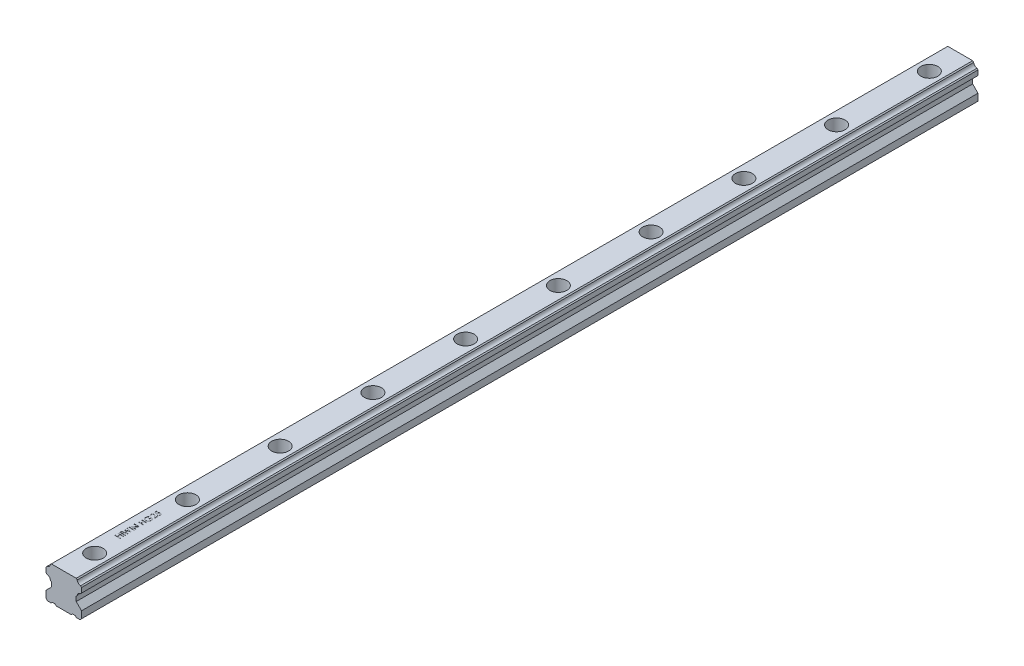
from build123d import *

# Parameters (mm, degrees)
EXTRUDE_1_DEPTH              = 580
HOLE_WIZARD_M6_1_D           = 7
HOLE_WIZARD_M6_1_CBORE_D     = 11
HOLE_WIZARD_M6_1_CBORE_DEPTH = 9
PATTERN_LINEAR_1_COUNT       = 10
PATTERN_LINEAR_1_PITCH       = 60
SKETCH_6_W                   = 3.5
SKETCH_6_H                   = 0.314102564
CUT_EXTRUDE_1_DEPTH          = 0.1


with BuildPart() as part:
    # 草图1 → 凸台-拉伸1 (new body)
    with BuildSketch(Plane.XY):
        with BuildLine():
            Line((8.05, 8.95), (8.05, 11.95))
            Line((8.05, 11.95), (8.699273501, 12.599273501))
            ThreePointArc((8.699273501, 12.599273501), (9.368413601, 14.081586399), (10.850726499, 14.750726499))
            Line((10.850726499, 14.750726499), (11.5, 15.4))
            Line((11.5, 15.4), (11.5, 18.55))
            Line((11.5, 18.55), (10.850726499, 19.199273501))
            ThreePointArc((10.850726499, 19.199273501), (9.368413601, 19.868413601), (8.699273501, 21.350726499))
            Line((8.699273501, 21.350726499), (8.05, 22))
            Line((8.05, 22), (-8.05, 22))
            Line((-8.05, 22), (-8.699273501, 21.350726499))
            ThreePointArc((-8.699273501, 21.350726499), (-9.368413601, 19.868413601), (-10.850726499, 19.199273501))
            Line((-10.850726499, 19.199273501), (-11.5, 18.55))
            Line((-11.5, 18.55), (-11.5, 15.4))
            Line((-11.5, 15.4), (-10.850726499, 14.750726499))
            ThreePointArc((-10.850726499, 14.750726499), (-9.368413601, 14.081586399), (-8.699273501, 12.599273501))
            Line((-8.699273501, 12.599273501), (-8.05, 11.95))
            Line((-8.05, 11.95), (-8.05, 8.95))
            Line((-8.05, 8.95), (-11.5, 5.5))
            Line((-11.5, 5.5), (-11.5, 1))
            Line((-11.5, 1), (-10.5, 0))
            Line((-10.5, 0), (-8.214285714, 0))
            Line((-8.214285714, 0), (-7.447619048, 0.766666667))
            Line((-7.447619048, 0.766666667), (-5.695238095, 0.766666667))
            Line((-5.695238095, 0.766666667), (-4.928571429, 0))
            Line((-4.928571429, 0), (4.928571429, 0))
            Line((4.928571429, 0), (5.695238095, 0.766666667))
            Line((5.695238095, 0.766666667), (7.447619048, 0.766666667))
            Line((7.447619048, 0.766666667), (8.214285714, 0))
            Line((8.214285714, 0), (10.5, 0))
            Line((10.5, 0), (11.5, 1))
            Line((11.5, 1), (11.5, 5.5))
            Line((11.5, 5.5), (8.05, 8.95))
        make_face()
    extrude(amount=-EXTRUDE_1_DEPTH)

    # M6 六角凹头螺钉的柱形沉头孔1 (through all)
    with Locations(Plane(origin=(-2.772540883, 22, -12.140035403), x_dir=(-1, 0, 0), z_dir=(0, 1, 0))):
        with Locations((-2.772540883, -7.859964597)):
            hole_wizard_m6_1 = CounterBoreHole(HOLE_WIZARD_M6_1_D / 2, HOLE_WIZARD_M6_1_CBORE_D / 2, HOLE_WIZARD_M6_1_CBORE_DEPTH)

    # 阵列(线性)1: M6 六角凹头螺钉的柱形沉头孔1 ×10
    with Locations(*[(0, 0, -i * PATTERN_LINEAR_1_PITCH) for i in range(1, PATTERN_LINEAR_1_COUNT)]):
        add(hole_wizard_m6_1, mode=Mode.SUBTRACT)

    # 草图6 → 切除-拉伸1 (cut)
    with BuildSketch(Plane(origin=(0, 22, 0), x_dir=(1, 0, 0), z_dir=(0, 1, 0))):
        Polygon((-3.5, 36.403846154), (-3.5, 36.717948718), (-2.064102564, 36.717948718), (-2.064102564, 38.512820513), (-3.5, 38.512820513), (-3.5, 38.826923077), (0, 38.826923077), (0, 38.512820513), (-1.705128205, 38.512820513), (-1.705128205, 36.717948718), (0, 36.717948718), (0, 36.403846154), align=None)
        with Locations((-1.75, 39.881410256)):
            Rectangle(SKETCH_6_W, SKETCH_6_H)
        Polygon((-3.5, 40.576923077), (-3.5, 40.901542468), (-0.933193109, 41.586538462), (-3.5, 42.605268429), (-3.5, 42.650841346), (-0.950721154, 43.650641026), (-3.5, 44.339142628), (-3.5, 44.66025641), (0, 43.716546474), (0, 43.671674679), (-2.676883013, 42.618589744), (0, 41.552884615), (0, 41.508012821), align=None)
        with Locations((-1.75, 45.625)):
            Rectangle(SKETCH_6_W, SKETCH_6_H)
        Polygon((0, 46.544871795), (-3.5, 46.544871795), (-3.5, 46.610777244), (-0.745292468, 48.923076923), (-3.5, 48.923076923), (-3.5, 49.237179487), (0, 49.237179487), (0, 49.165665064), (-2.748397436, 46.858974359), (0, 46.858974359), align=None)
        Polygon((-3.5, 51.480769231), (-3.5, 51.794871795), (-2.064102564, 51.794871795), (-2.064102564, 53.58974359), (-3.5, 53.58974359), (-3.5, 53.903846154), (0, 53.903846154), (0, 53.58974359), (-1.705128205, 53.58974359), (-1.705128205, 51.794871795), (0, 51.794871795), (0, 51.480769231), align=None)
        with BuildLine():
            Line((-2.902644231, 58.076923077), (-2.647435897, 57.807692308))
            add(Edge.make_bspline(
                [(-2.647435897, 57.807692308), (-2.69328212, 57.758983227), (-2.783881335, 57.662726562), (-2.901244074, 57.50552662), (-3.002777003, 57.342170767), (-3.084772592, 57.172394867), (-3.149094254, 57.000650867), (-3.195850217, 56.829891913), (-3.225460377, 56.661223615), (-3.229016796, 56.549059313), (-3.230769231, 56.493790064)],
                knots=[0, 0, 0, 0, 1.089067066, 2.152164705, 3.18986567, 4.218445106, 5.218487318, 6.173592265, 7.100032889, 8, 8, 8, 8], degree=3))
            add(Edge.make_bspline(
                [(-3.230769231, 56.493790064), (-3.230355625, 56.459875364), (-3.229529486, 56.392133924), (-3.218985271, 56.29151198), (-3.203820407, 56.191945342), (-3.181878529, 56.093621968), (-3.15406947, 55.99635068), (-3.119284004, 55.900469793), (-3.078728771, 55.805800421), (-3.031866252, 55.713234402), (-2.980386575, 55.623493669), (-2.923337414, 55.538737672), (-2.862550889, 55.458421211), (-2.796491613, 55.384072004), (-2.725807311, 55.31519549), (-2.651770944, 55.250524789), (-2.572926872, 55.191265211), (-2.489599321, 55.138479571), (-2.403726867, 55.090811977), (-2.316037795, 55.049619777), (-2.227346143, 55.013809823), (-2.136984078, 54.986535862), (-2.045883197, 54.963434988), (-1.953566086, 54.947353752), (-1.859791669, 54.938257435), (-1.796993971, 54.936686944), (-1.765424679, 54.935897436)],
                knots=[0, 0, 0, 0, 1.028150113, 2.053633673, 3.06513288, 4.081487945, 5.106702018, 6.131327874, 7.172780699, 8.228344599, 9.276313556, 10.308389736, 11.324843658, 12.329040066, 13.321460474, 14.316307835, 15.308626991, 16.309440696, 17.305625405, 18.28535951, 19.246194545, 20.203493668, 21.145557131, 22.095268976, 23.042464743, 24, 24, 24, 24], degree=3))
            add(Edge.make_bspline(
                [(-1.765424679, 54.935897436), (-1.733154018, 54.936653631), (-1.668700816, 54.938163957), (-1.572504414, 54.947817154), (-1.477747832, 54.965772364), (-1.384282029, 54.989584114), (-1.291920993, 55.019856789), (-1.20076111, 55.057049303), (-1.110811241, 55.101355435), (-1.022964324, 55.152526704), (-0.937464192, 55.209036172), (-0.856251713, 55.271187356), (-0.780271995, 55.339084893), (-0.708415252, 55.411483836), (-0.641134974, 55.489043832), (-0.579242122, 55.572517364), (-0.521779643, 55.660735956), (-0.469378807, 55.753738745), (-0.42257144, 55.850542725), (-0.38094723, 55.949799156), (-0.346667976, 56.051827058), (-0.31872985, 56.156089724), (-0.295829559, 56.262463002), (-0.281097077, 56.371486803), (-0.270406246, 56.482359512), (-0.269624576, 56.557098144), (-0.269230769, 56.594751603)],
                knots=[0, 0, 0, 0, 0.935915162, 1.869274651, 2.799799983, 3.730201895, 4.664668062, 5.616159355, 6.583070886, 7.570012957, 8.562524459, 9.553461134, 10.53281078, 11.515274572, 12.509912756, 13.507571325, 14.526460018, 15.561318395, 16.601025881, 17.643204557, 18.680545676, 19.719612342, 20.772381578, 21.833430283, 22.908478249, 24, 24, 24, 24], degree=3))
            add(Edge.make_bspline(
                [(-0.269230769, 56.594751603), (-0.270178952, 56.640130135), (-0.272040863, 56.729238255), (-0.286546735, 56.860222075), (-0.309173205, 56.986034693), (-0.342412256, 57.106266531), (-0.384484705, 57.221353926), (-0.436513285, 57.330872414), (-0.497950569, 57.435124408), (-0.567552463, 57.533658668), (-0.645100929, 57.624132689), (-0.728035637, 57.706474768), (-0.817431068, 57.77785339), (-0.911954918, 57.840400707), (-1.012511326, 57.892097951), (-1.118540888, 57.934543829), (-1.230109213, 57.967076285), (-1.307200733, 57.980431374), (-1.346153846, 57.987179487)],
                knots=[0, 0, 0, 0, 1.130199668, 2.219330667, 3.279027493, 4.311506524, 5.322739849, 6.327972234, 7.327472899, 8.33386792, 9.329086447, 10.29244429, 11.240784345, 12.174119183, 13.111530729, 14.052100829, 15.015757696, 16, 16, 16, 16], degree=3))
            Line((-1.346153846, 57.987179487), (-1.346153846, 56.820512821))
            Line((-1.346153846, 56.820512821), (-1.705128205, 56.820512821))
            Line((-1.705128205, 56.820512821), (-1.705128205, 58.301282051))
            add(Edge.make_bspline(
                [(-1.705128205, 58.301282051), (-1.638220716, 58.299576203), (-1.507270675, 58.296237549), (-1.316300404, 58.272818634), (-1.13592871, 58.235002122), (-0.965965639, 58.18334181), (-0.806652046, 58.116466529), (-0.65782618, 58.035094001), (-0.520449499, 57.93792188), (-0.393400495, 57.828411438), (-0.280071283, 57.705511481), (-0.180465345, 57.572542861), (-0.09656273, 57.429285892), (-0.028302067, 57.275876085), (0.024971927, 57.112815651), (0.062743504, 56.939727272), (0.085373467, 56.756845671), (0.088264847, 56.631508994), (0.08974359, 56.567407853)],
                knots=[0, 0, 0, 0, 1.140356446, 2.231883559, 3.274166699, 4.278491846, 5.25512956, 6.21435461, 7.1637429, 8.11826594, 9.068280886, 10.0076534, 10.945064095, 11.891975133, 12.864533718, 13.863980011, 14.907571808, 16, 16, 16, 16], degree=3))
            add(Edge.make_bspline(
                [(0.08974359, 56.567407853), (0.089174469, 56.527897717), (0.088051978, 56.449970996), (0.080074631, 56.334880068), (0.067794054, 56.222962448), (0.049248931, 56.114234439), (0.026534277, 56.008296097), (-0.002552442, 55.905676512), (-0.036221141, 55.80598477), (-0.074516815, 55.709066784), (-0.118888472, 55.615802237), (-0.168198111, 55.52577572), (-0.222191472, 55.438489595), (-0.281802318, 55.35453843), (-0.346584778, 55.273484808), (-0.416668697, 55.195851364), (-0.491839816, 55.121203486), (-0.545218826, 55.074443023), (-0.572115385, 55.05088141)],
                knots=[0, 0, 0, 0, 1.107784379, 2.184907829, 3.233506516, 4.263428166, 5.276301166, 6.270063455, 7.25232949, 8.225834625, 9.190232166, 10.146266622, 11.1027726, 12.066435141, 13.031522626, 14.010570082, 14.99756817, 16, 16, 16, 16], degree=3))
            add(Edge.make_bspline(
                [(-0.572115385, 55.05088141), (-0.614786038, 55.016695478), (-0.699419055, 54.948891066), (-0.835018999, 54.861612909), (-0.975420859, 54.787211506), (-1.121015488, 54.726843684), (-1.271666701, 54.679705598), (-1.427181992, 54.645899345), (-1.587761622, 54.626092056), (-1.696426887, 54.623238518), (-1.751402244, 54.621794872)],
                knots=[0, 0, 0, 0, 1.023165419, 2.029347347, 3.013907458, 3.994755782, 4.975994455, 5.96558838, 6.970761222, 8, 8, 8, 8], degree=3))
            add(Edge.make_bspline(
                [(-1.751402244, 54.621794872), (-1.792568496, 54.62232711), (-1.874377804, 54.623384821), (-1.99583511, 54.636210339), (-2.115135808, 54.654611751), (-2.232182344, 54.681658827), (-2.347053012, 54.715755013), (-2.45980069, 54.758308794), (-2.570493643, 54.807852572), (-2.67836343, 54.865442289), (-2.782003044, 54.929511026), (-2.880905313, 54.999118682), (-2.973467332, 55.074802367), (-3.059903521, 55.156782462), (-3.141494975, 55.243406392), (-3.216537375, 55.336492693), (-3.286205011, 55.434631029), (-3.349159221, 55.538582169), (-3.405727075, 55.6467058), (-3.455315154, 55.758766886), (-3.496298775, 55.874724704), (-3.531072472, 55.993712261), (-3.556787635, 56.11662974), (-3.575436374, 56.242585283), (-3.588196976, 56.372235393), (-3.589223231, 56.459871423), (-3.58974359, 56.504306891)],
                knots=[0, 0, 0, 0, 1.00895651, 2.005089799, 2.991467152, 3.967318338, 4.948153826, 5.927364234, 6.919980553, 7.91976625, 8.923240147, 9.905815003, 10.88314567, 11.851989312, 12.825009789, 13.798721852, 14.781296708, 15.773896486, 16.776076962, 17.771600213, 18.775744723, 19.78957137, 20.808953803, 21.851964491, 22.910847925, 24, 24, 24, 24], degree=3))
            add(Edge.make_bspline(
                [(-3.58974359, 56.504306891), (-3.589164098, 56.540545135), (-3.588015034, 56.612401313), (-3.580050386, 56.719327046), (-3.567426505, 56.82460006), (-3.550199718, 56.92837645), (-3.526736028, 57.030302816), (-3.498657743, 57.130669522), (-3.46596592, 57.229622058), (-3.426977074, 57.326850307), (-3.382723449, 57.423008023), (-3.332910027, 57.518629864), (-3.276685022, 57.61338911), (-3.213881487, 57.707450091), (-3.145578069, 57.801405949), (-3.069821245, 57.893770591), (-2.989598489, 57.986773536), (-2.931916305, 58.04657535), (-2.902644231, 58.076923077)],
                knots=[0, 0, 0, 0, 0.985871117, 1.954866573, 2.915460327, 3.869826059, 4.81536089, 5.759505086, 6.70452669, 7.649098992, 8.607881297, 9.583363685, 10.581137262, 11.603961102, 12.659522466, 13.73993555, 14.853081303, 16, 16, 16, 16], degree=3))
        make_face()
        with BuildLine():
            Line((-2.423076923, 59.153846154), (-2.423076923, 58.83974359))
            add(Edge.make_bspline(
                [(-2.423076923, 58.83974359), (-2.464747811, 58.841790743), (-2.546588325, 58.845811297), (-2.665912232, 58.864639586), (-2.779967031, 58.891580463), (-2.887836945, 58.929671917), (-2.990475752, 58.976978195), (-3.087475767, 59.033708222), (-3.178466956, 59.100902073), (-3.262605799, 59.177108807), (-3.33979337, 59.259877446), (-3.406448613, 59.349183385), (-3.462766284, 59.443028413), (-3.509847526, 59.541127812), (-3.545187372, 59.644588375), (-3.571409012, 59.752471233), (-3.587185357, 59.86525037), (-3.588881143, 59.942090392), (-3.58974359, 59.981169872)],
                knots=[0, 0, 0, 0, 1.10065271, 2.161652631, 3.183658789, 4.190468796, 5.17591951, 6.163126047, 7.15150782, 8.156236427, 9.156009102, 10.134482811, 11.092018607, 12.041330605, 13.001268258, 13.972401359, 14.968799086, 16, 16, 16, 16], degree=3))
            add(Edge.make_bspline(
                [(-3.58974359, 59.981169872), (-3.588852424, 60.019550647), (-3.587101316, 60.094967498), (-3.571837144, 60.204991306), (-3.54844616, 60.309980405), (-3.513784407, 60.408744955), (-3.47029149, 60.502298559), (-3.416202348, 60.589482867), (-3.354076299, 60.672406087), (-3.280795578, 60.746998492), (-3.202604863, 60.815520614), (-3.119097837, 60.874582541), (-3.032749001, 60.925447137), (-2.942883845, 60.96707822), (-2.849209723, 60.998636432), (-2.752624723, 61.022018043), (-2.652014188, 61.035384235), (-2.583905673, 61.037424337), (-2.549278846, 61.038461538)],
                knots=[0, 0, 0, 0, 1.111674182, 2.184400057, 3.212814286, 4.223731311, 5.211378316, 6.196328225, 7.191884489, 8.207283132, 9.220262353, 10.201199469, 11.166417575, 12.120932471, 13.06540007, 14.026332106, 14.996573967, 16, 16, 16, 16], degree=3))
            add(Edge.make_bspline(
                [(-2.549278846, 61.038461538), (-2.500531033, 61.036768249), (-2.403890861, 61.033411385), (-2.26187569, 61.004697398), (-2.124283442, 60.959849403), (-2.013542366, 60.905856831), (-1.924317319, 60.851373677), (-1.850817554, 60.80232555), (-1.771698892, 60.744580059), (-1.686641103, 60.678630555), (-1.59675809, 60.603341294), (-1.500215998, 60.520668282), (-1.398799957, 60.428476459), (-1.329486308, 60.363827827), (-1.293569712, 60.330328526)],
                knots=[0, 0, 0, 0, 1.184416499, 2.348048165, 3.509039915, 4.696071444, 5.333504901, 6.05069495, 6.844171097, 7.714965912, 8.667477798, 9.695072654, 10.805644396, 12, 12, 12, 12], degree=3))
            Line((-1.293569712, 60.330328526), (-0.358974359, 59.454627404))
            Line((-0.358974359, 59.454627404), (-0.358974359, 61.083333333))
            Line((-0.358974359, 61.083333333), (0, 61.083333333))
            Line((0, 61.083333333), (0, 58.705128205))
            Line((0, 58.705128205), (-1.448517628, 60.0625))
            add(Edge.make_bspline(
                [(-1.448517628, 60.0625), (-1.483015935, 60.095547887), (-1.549280121, 60.159026114), (-1.646023081, 60.248808691), (-1.735772622, 60.329447679), (-1.818359171, 60.401465072), (-1.894990738, 60.463298577), (-1.963185442, 60.518170809), (-2.025939892, 60.5621364), (-2.098680506, 60.609851796), (-2.187492823, 60.656065777), (-2.296026513, 60.695778133), (-2.407753765, 60.719992982), (-2.483255802, 60.722897817), (-2.521233974, 60.724358974)],
                knots=[0, 0, 0, 0, 1.329631726, 2.553950428, 3.673215718, 4.687767853, 5.603093632, 6.413772471, 7.123043292, 7.734684054, 8.834405432, 9.900288307, 10.943827018, 12, 12, 12, 12], degree=3))
            add(Edge.make_bspline(
                [(-2.521233974, 60.724358974), (-2.545115373, 60.723723232), (-2.592181023, 60.722470306), (-2.661186782, 60.711412609), (-2.727751596, 60.694702102), (-2.792080215, 60.670756844), (-2.853525867, 60.639150104), (-2.912163347, 60.600676724), (-2.968852313, 60.556286661), (-3.022005611, 60.504935392), (-3.070686816, 60.448523872), (-3.113810902, 60.388929622), (-3.149850012, 60.325879518), (-3.179393509, 60.259639396), (-3.202568891, 60.190393926), (-3.21862747, 60.118009181), (-3.228709954, 60.042685165), (-3.230074126, 59.991251669), (-3.230769231, 59.965044071)],
                knots=[0, 0, 0, 0, 0.991446411, 1.95395049, 2.89581595, 3.838931463, 4.798493298, 5.75982156, 6.748411868, 7.785213223, 8.824556874, 9.840280684, 10.836137867, 11.835679398, 12.848801643, 13.863922112, 14.911575587, 16, 16, 16, 16], degree=3))
            add(Edge.make_bspline(
                [(-3.230769231, 59.965044071), (-3.230082413, 59.937666368), (-3.228733615, 59.88390108), (-3.218517149, 59.80512929), (-3.203028983, 59.72946555), (-3.178430394, 59.65803883), (-3.149365939, 59.589302431), (-3.11244268, 59.524723765), (-3.069537034, 59.46323063), (-3.019786187, 59.405834468), (-2.963887514, 59.353413504), (-2.902283318, 59.306707183), (-2.835417099, 59.266166102), (-2.76356329, 59.230744984), (-2.686006495, 59.20199263), (-2.603039645, 59.180018534), (-2.515018024, 59.162631952), (-2.454232973, 59.156823394), (-2.423076923, 59.153846154)],
                knots=[0, 0, 0, 0, 1.030878251, 2.024474673, 2.987898669, 3.934362936, 4.864849709, 5.795128259, 6.730474222, 7.685293701, 8.650606017, 9.611896181, 10.591709709, 11.591680886, 12.625074257, 13.701333388, 14.821793024, 16, 16, 16, 16], degree=3))
        make_face()
        with BuildLine():
            Line((-3.5, 63.596153846), (-3.141025641, 63.596153846))
            Line((-3.141025641, 63.596153846), (-3.141025641, 62.405649038))
            Line((-3.141025641, 62.405649038), (-2.220452724, 62.217047276))
            add(Edge.make_bspline(
                [(-2.220452724, 62.217047276), (-2.230682996, 62.25410315), (-2.25050253, 62.325893046), (-2.2725083, 62.431852907), (-2.285773744, 62.53244511), (-2.287585055, 62.597720481), (-2.288461538, 62.629306891)],
                knots=[0, 0, 0, 0, 1.100273476, 2.13160584, 3.095893838, 4, 4, 4, 4], degree=3))
            add(Edge.make_bspline(
                [(-2.288461538, 62.629306891), (-2.28764354, 62.668397805), (-2.28603515, 62.745260309), (-2.269673986, 62.857544614), (-2.245976174, 62.96527195), (-2.209465207, 63.066851732), (-2.164878805, 63.163891055), (-2.108721258, 63.254723386), (-2.04315746, 63.34062356), (-1.968525078, 63.420997879), (-1.885534459, 63.493570878), (-1.795933934, 63.556634421), (-1.701678739, 63.611677196), (-1.600559725, 63.654605621), (-1.494484031, 63.689639403), (-1.382227183, 63.712740767), (-1.264785773, 63.728171477), (-1.18448027, 63.729891917), (-1.143529647, 63.730769231)],
                knots=[0, 0, 0, 0, 1.052805225, 2.070078116, 3.052532748, 4.020689046, 4.973125432, 5.925915817, 6.89216474, 7.881560752, 8.877013184, 9.857446635, 10.830895175, 11.812622661, 12.812548702, 13.836681939, 14.896847428, 16, 16, 16, 16], degree=3))
            add(Edge.make_bspline(
                [(-1.143529647, 63.730769231), (-1.115007605, 63.730103556), (-1.058348972, 63.728781204), (-0.974202158, 63.7220714), (-0.891849045, 63.709103007), (-0.811440613, 63.69190289), (-0.732901554, 63.668941583), (-0.65579213, 63.642084161), (-0.580956685, 63.608702163), (-0.508064701, 63.571694489), (-0.437950402, 63.530715464), (-0.372294905, 63.484635462), (-0.309599937, 63.436755685), (-0.251727444, 63.384438189), (-0.198452948, 63.328277796), (-0.149513072, 63.268586987), (-0.104029493, 63.205907167), (-0.063861909, 63.139251137), (-0.026898788, 63.070108867), (0.003424705, 62.997480593), (0.030535245, 62.923019908), (0.05214477, 62.845655028), (0.069077325, 62.765561217), (0.080577925, 62.682606441), (0.088954363, 62.597225771), (0.08947872, 62.539350758), (0.08974359, 62.510116186)],
                knots=[0, 0, 0, 0, 1.056393913, 2.098511576, 3.122979385, 4.141471433, 5.141222888, 6.151259816, 7.162667642, 8.172852865, 9.177685681, 10.166741883, 11.141342384, 12.097242845, 13.052202613, 14.005160326, 14.953864445, 15.917140761, 16.884916217, 17.854238259, 18.828761908, 19.81781811, 20.826036654, 21.857789401, 22.917898972, 24, 24, 24, 24], degree=3))
            add(Edge.make_bspline(
                [(0.08974359, 62.510116186), (0.089050894, 62.475242894), (0.087688097, 62.406633813), (0.073496095, 62.30610057), (0.053035464, 62.209432256), (0.022721931, 62.117043177), (-0.016971483, 62.029318648), (-0.064133263, 61.945002475), (-0.12027864, 61.865139718), (-0.184894072, 61.790276377), (-0.255892818, 61.721460371), (-0.332202561, 61.65905751), (-0.413920487, 61.604193873), (-0.500780871, 61.556670445), (-0.592629648, 61.516184815), (-0.689749822, 61.484366409), (-0.791650601, 61.45868899), (-0.861804004, 61.447825441), (-0.897435897, 61.442307692)],
                knots=[0, 0, 0, 0, 1.046872515, 2.059598001, 3.044168548, 4.012104806, 4.973680974, 5.932408326, 6.910122221, 7.900780896, 8.89867654, 9.876692837, 10.858029398, 11.85084981, 12.847361615, 13.868568023, 14.917415949, 16, 16, 16, 16], degree=3))
            Line((-0.897435897, 61.442307692), (-0.897435897, 61.756410256))
            add(Edge.make_bspline(
                [(-0.897435897, 61.756410256), (-0.86405597, 61.764133979), (-0.799897896, 61.778979402), (-0.709812799, 61.811649494), (-0.62950762, 61.851206459), (-0.558491359, 61.899340396), (-0.495464081, 61.955133792), (-0.43989307, 62.019990731), (-0.389697273, 62.092289811), (-0.347784769, 62.17267219), (-0.312479137, 62.257640252), (-0.287283878, 62.346063351), (-0.272032646, 62.436668904), (-0.270168243, 62.497671524), (-0.269230769, 62.528345353)],
                knots=[0, 0, 0, 0, 1.13623081, 2.183898708, 3.172478118, 4.09966615, 5.022692284, 5.957376522, 6.927682873, 7.937366477, 8.960015386, 9.976409503, 10.982481913, 12, 12, 12, 12], degree=3))
            add(Edge.make_bspline(
                [(-0.269230769, 62.528345353), (-0.270058415, 62.558301256), (-0.271688055, 62.617284674), (-0.284028564, 62.704132513), (-0.303533592, 62.787735767), (-0.33085902, 62.868242843), (-0.367008958, 62.945258145), (-0.411417074, 63.018672781), (-0.462975425, 63.089532607), (-0.521904738, 63.1559727), (-0.586881759, 63.216808942), (-0.656357238, 63.270565902), (-0.730474586, 63.315342595), (-0.807947606, 63.353076763), (-0.889626199, 63.381730046), (-0.975127364, 63.402171031), (-1.064662347, 63.414174089), (-1.125731657, 63.415825269), (-1.156850962, 63.416666667)],
                knots=[0, 0, 0, 0, 1.027268864, 2.022700798, 3.002744649, 3.968653148, 4.933396556, 5.915045722, 6.907600446, 7.935526002, 8.956456544, 9.95700807, 10.942805781, 11.92166854, 12.907987664, 13.905483474, 14.932689774, 16, 16, 16, 16], degree=3))
            add(Edge.make_bspline(
                [(-1.156850962, 63.416666667), (-1.184930032, 63.416028195), (-1.239659043, 63.414783746), (-1.320009695, 63.404010642), (-1.396158478, 63.386014341), (-1.468436727, 63.360391264), (-1.536613353, 63.328412845), (-1.600538112, 63.288262971), (-1.660812066, 63.241651258), (-1.715884112, 63.187233139), (-1.766793088, 63.12803749), (-1.810034281, 63.062543866), (-1.846807397, 62.992500701), (-1.876936465, 62.917778197), (-1.900936575, 62.838284311), (-1.917523378, 62.753976228), (-1.92744867, 62.664834733), (-1.928795087, 62.603859089), (-1.929487179, 62.572516026)],
                knots=[0, 0, 0, 0, 1.045723156, 2.038222538, 3.013889863, 3.95567481, 4.890389958, 5.81331128, 6.76251276, 7.723027653, 8.692928204, 9.666105983, 10.639751036, 11.635719707, 12.66315958, 13.728667616, 14.832476222, 16, 16, 16, 16], degree=3))
            add(Edge.make_bspline(
                [(-1.929487179, 62.572516026), (-1.928906588, 62.545387097), (-1.927707815, 62.489372742), (-1.918881318, 62.403449915), (-1.904642024, 62.313158192), (-1.885055776, 62.218843696), (-1.859424699, 62.120223188), (-1.828710199, 62.017504787), (-1.7919882, 61.910472521), (-1.764255986, 61.838354796), (-1.75, 61.801282051)],
                knots=[0, 0, 0, 0, 0.817624296, 1.688186739, 2.600797293, 3.572016777, 4.590301741, 5.671205678, 6.80286297, 8, 8, 8, 8], degree=3))
            Line((-1.75, 61.801282051), (-3.5, 62.16025641))
            Line((-3.5, 62.16025641), (-3.5, 63.596153846))
        make_face()
    extrude(amount=-CUT_EXTRUDE_1_DEPTH, mode=Mode.SUBTRACT)


solid = part.part
